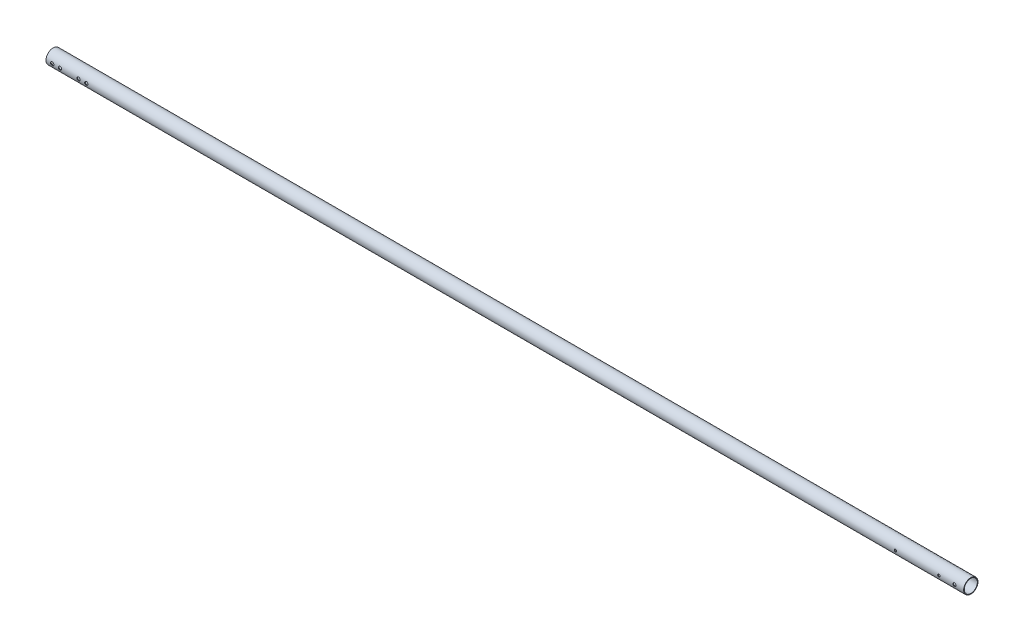
from build123d import *

# Parameters (mm, degrees)
SKETCH1_R               = 14.732
SKETCH1_R_2             = 13.3858
BOSS_EXTRUDE1_DEPTH     = 1881.1875
CUT_EXTRUDE2_DEPTH      = 1882.302866049
CUT_EXTRUDE2_DEPTH_BACK = 1882.302866049
SKETCH2_R               = 2.4638
SKETCH2_R_2             = 3.175
SKETCH3_R               = 3.3655
CUT_EXTRUDE3_DEPTH      = 1882.302866151
LPATTERN1_COUNT         = 2
LPATTERN1_PITCH         = 53.975


with BuildPart() as part:
    # Sketch1 → Boss-Extrude1 (new body)
    with BuildSketch(Plane(origin=(0, 0, 0), x_dir=(0, 0, -1), z_dir=(1, 0, 0))):
        Circle(SKETCH1_R)
        Circle(SKETCH1_R_2, mode=Mode.SUBTRACT)
    extrude(amount=BOSS_EXTRUDE1_DEPTH)

    # Sketch2 → Cut-Extrude2 (cut, two sides: drawn at the far end of the back side and taken through both)
    with BuildSketch(Plane.XY.offset(-CUT_EXTRUDE2_DEPTH_BACK)):
        with Locations((1830.3875, 0)):
            Circle(SKETCH2_R)
        with Locations((1741.4875, 0)):
            Circle(SKETCH2_R)
        with Locations((1862.1375, 0)):
            Circle(SKETCH2_R_2)
    extrude(amount=CUT_EXTRUDE2_DEPTH + CUT_EXTRUDE2_DEPTH_BACK, mode=Mode.SUBTRACT)

    # Sketch3 → Cut-Extrude3 (cut, symmetric)
    with BuildSketch(Plane.XY):
        with Locations((12.7, 0)):
            Circle(SKETCH3_R)
        with Locations((28.575, 0)):
            Circle(SKETCH3_R)
    cut_extrude3 = extrude(amount=CUT_EXTRUDE3_DEPTH, both=True, mode=Mode.SUBTRACT)

    # LPattern1: Cut-Extrude3 ×2
    with Locations(*[(i * LPATTERN1_PITCH, 0, 0) for i in range(1, LPATTERN1_COUNT)]):
        add(cut_extrude3, mode=Mode.SUBTRACT)


solid = part.part
